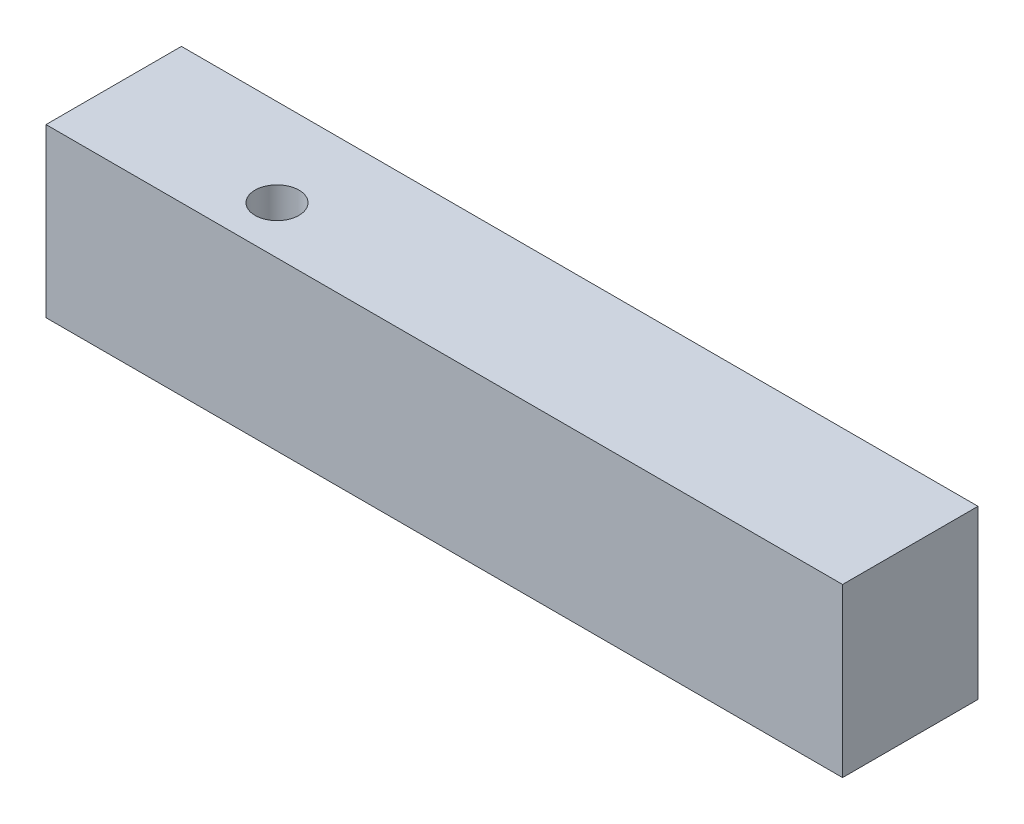
from build123d import *

# Parameters (mm, degrees)
SKETCH1_W           = 25.4
SKETCH1_H           = 5.334
BOSS_EXTRUDE1_DEPTH = 4.318
SKETCH2_R           = 0.700000022
CUT_EXTRUDE2_DEPTH  = 22.718057664


with BuildPart() as part:
    # Sketch1 → Boss-Extrude1 (new body)
    with BuildSketch(Plane.XY):
        with Locations((7.905274778, -0.284534644)):
            Rectangle(SKETCH1_W, SKETCH1_H)
    extrude(amount=BOSS_EXTRUDE1_DEPTH)

    # Sketch2 → Cut-Extrude2 (cut, through all)
    with BuildSketch(Plane(origin=(0, 2.382465356, 0), x_dir=(1, 0, 0), z_dir=(0, 1, 0))):
        with Locations((1.047274778, -2.794)):
            Circle(SKETCH2_R)
    extrude(amount=-CUT_EXTRUDE2_DEPTH, mode=Mode.SUBTRACT)


solid = part.part
